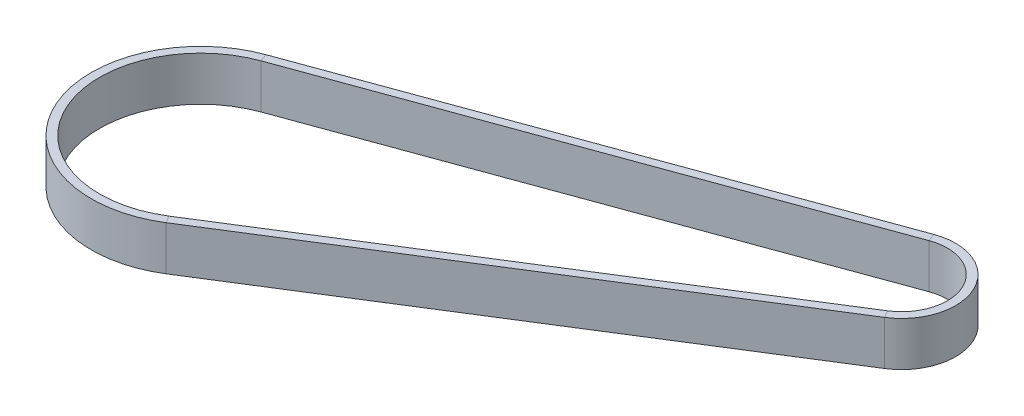
from build123d import *

# Parameters (mm, degrees)
SKETCH2_W = 3
SKETCH2_H = 16


with BuildPart() as part:
    # Sweep1: sweep along a path in Sketch1
    with BuildLine(Plane(origin=(0, 0, 0), x_dir=(1, 0, 0), z_dir=(0, 1, 0))) as sweep1_path:
        Line((-21.907810156, 552.714503657), (154.93274494, 617.106916737))
        ThreePointArc((154.93274494, 617.106916737), (177.259535828, 608.104871657), (170.667286269, 584.951801607))
        Line((170.667286269, 584.951801607), (11.309554872, 484.831482825))
        ThreePointArc((11.309554872, 484.831482825), (-43.038733047, 500.305779593), (-21.907810156, 552.714503657))
    # Sketch2 → Sweep1 (sweep)
    with BuildSketch(Plane(origin=(11.309554872, 0, -484.831482825), x_dir=(0.5319910082717635, 0, 0.8467500027268925), z_dir=(-0.8467500027268925, 0, 0.5319910082717635))):
        Rectangle(SKETCH2_W, SKETCH2_H)
    sweep(path=sweep1_path.line)


solid = part.part
